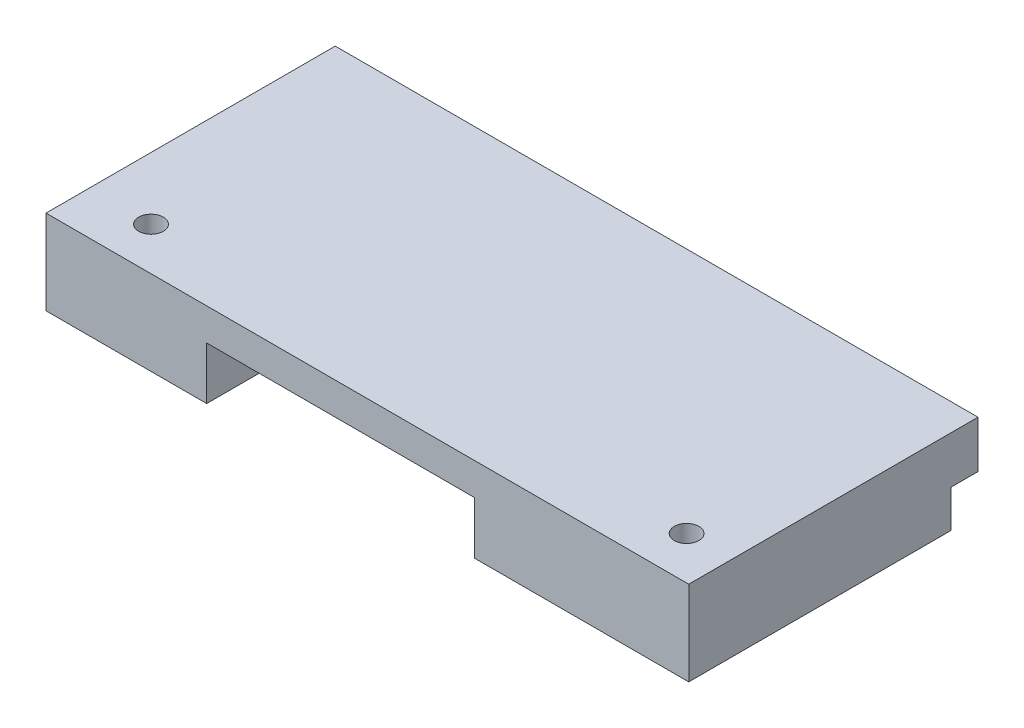
from build123d import *

# Parameters (mm, degrees)
SKETCH1_W                  = 60
SKETCH1_H                  = 2.5
BOSS_EXTRUDE1_DEPTH        = 2.5
SKETCH2_W                  = 60
SKETCH2_H                  = 5
BOSS_EXTRUDE2_DEPTH        = 3
SKETCH5_W                  = 60
SKETCH5_H                  = 5.5
BOSS_EXTRUDE4_DEPTH        = 22
SKETCH6_W                  = 60
SKETCH6_H                  = 27
BOSS_EXTRUDE5_DEPTH        = 2.4
F_2_3_2_3_DIAMETER_HOLE1_D = 2.3
SKETCH9_W                  = 25
SKETCH9_H                  = 9.609635329
CUT_EXTRUDE1_DEPTH         = 42.126755282
SKETCH10_W                 = 60
SKETCH10_H                 = 3.5
CUT_EXTRUDE2_DEPTH         = 40.530494558


with BuildPart() as part:
    # Sketch1 → Boss-Extrude1 (new body)
    with BuildSketch(Plane(origin=(0, 0, 0), x_dir=(1, 0, 0), z_dir=(0, 1, 0))):
        Rectangle(SKETCH1_W, SKETCH1_H)
    extrude(amount=BOSS_EXTRUDE1_DEPTH)

    # Sketch2 → Boss-Extrude2 (add)
    with BuildSketch(Plane(origin=(0, 2.5, 0), x_dir=(1, 0, 0), z_dir=(0, 1, 0))):
        with Locations((0, 1.25)):
            Rectangle(SKETCH2_W, SKETCH2_H)
    extrude(amount=BOSS_EXTRUDE2_DEPTH)

    # Sketch5 → Boss-Extrude4 (add)
    with BuildSketch(Plane.XY.offset(1.25)):
        with Locations((0, 2.75)):
            Rectangle(SKETCH5_W, SKETCH5_H)
    extrude(amount=BOSS_EXTRUDE4_DEPTH)

    # Sketch6 → Boss-Extrude5 (add)
    with BuildSketch(Plane(origin=(0, 5.5, 0), x_dir=(1, 0, 0), z_dir=(0, 1, 0))):
        with Locations((0, -9.75)):
            Rectangle(SKETCH6_W, SKETCH6_H)
    extrude(amount=BOSS_EXTRUDE5_DEPTH)

    # Ø2.3 (2.3) Diameter Hole1 (through all)
    with Locations(Plane(origin=(0, 7.9, 0), x_dir=(1, 0, 0), z_dir=(0, 1, 0))):
        with Locations((-24.2, -19.25), (25.8, -19.25)):
            Hole(F_2_3_2_3_DIAMETER_HOLE1_D / 2)

    # Sketch9 → Cut-Extrude1 (cut, through all)
    with BuildSketch(Plane(origin=(0, 0, -3.75), x_dir=(-1, 0, 0), z_dir=(0, 0, -1))):
        with Locations((2.5, 0.095182336)):
            Rectangle(SKETCH9_W, SKETCH9_H)
    extrude(amount=-CUT_EXTRUDE1_DEPTH, mode=Mode.SUBTRACT)

    # Sketch10 → Cut-Extrude2 (cut, through all)
    with BuildSketch(Plane(origin=(0, 0, -1.25), x_dir=(-1, 0, 0), z_dir=(0, 0, -1))):
        with Locations((0, 1.75)):
            Rectangle(SKETCH10_W, SKETCH10_H)
    extrude(amount=CUT_EXTRUDE2_DEPTH, mode=Mode.SUBTRACT)


solid = part.part
